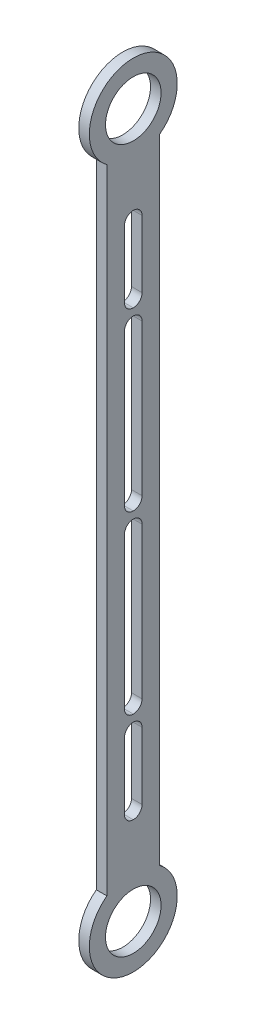
from build123d import *

# Parameters (mm, degrees)
SKETCH1_R           = 7.9
BOSS_EXTRUDE1_DEPTH = 3
SKETCH3_W           = 5
SKETCH3_H           = 150
CUT_EXTRUDE2_DEPTH  = 213.888468452
FILLET2_R           = 2.5
SKETCH4_W           = 5
SKETCH4_H           = 2
BOSS_EXTRUDE2_DEPTH = 3
FILLET3_R           = 2.5


with BuildPart() as part:
    # Sketch1 → Boss-Extrude1 (new body)
    with BuildSketch(Plane(origin=(0, 0, 0), x_dir=(0, 0, -1), z_dir=(1, 0, 0))):
        with BuildLine():
            Line((7.5, 10), (7.5, 190))
            ThreePointArc((7.5, 190), (0, 212.5), (-7.5, 190))
            Line((-7.5, 190), (-7.5, 10))
            ThreePointArc((-7.5, 10), (0, -12.5), (7.5, 10))
        make_face()
        Circle(SKETCH1_R, mode=Mode.SUBTRACT)
        with Locations((0, 200)):
            Circle(SKETCH1_R, mode=Mode.SUBTRACT)
    extrude(amount=BOSS_EXTRUDE1_DEPTH)

    # Sketch3 → Cut-Extrude2 (cut, through all)
    with BuildSketch(Plane(origin=(3, 0, 0), x_dir=(0, 0, -1), z_dir=(1, 0, 0))):
        with Locations((0, 100)):
            Rectangle(SKETCH3_W, SKETCH3_H)
    extrude(amount=-CUT_EXTRUDE2_DEPTH, mode=Mode.SUBTRACT)

    # Fillet2
    fillet2_edges = [part.edges().sort_by_distance(p)[0] for p in [
        (1.5, 175, 2.5),
        (1.5, 175, -2.5),
        (1.5, 25, 2.5),
        (1.5, 25, -2.5),
    ]]
    fillet(fillet2_edges, radius=FILLET2_R - 0.0001)  # a hair under: the kernel refuses the full size

    # Sketch4 → Boss-Extrude2 (add)
    with BuildSketch(Plane(origin=(3, 0, 0), x_dir=(0, 0, -1), z_dir=(1, 0, 0))):
        with Locations((0, 100.007044109)):
            Rectangle(SKETCH4_W, SKETCH4_H)
        with Locations((0, 50.007044109)):
            Rectangle(SKETCH4_W, SKETCH4_H)
        with Locations((0, 150.007044109)):
            Rectangle(SKETCH4_W, SKETCH4_H)
    extrude(amount=-BOSS_EXTRUDE2_DEPTH)

    # Fillet3
    fillet3_edges = [part.edges().sort_by_distance(p)[0] for p in [
        (1.5, 101.007044109, -2.5),
        (1.5, 101.007044109, 2.5),
        (1.5, 51.007044109, 2.5),
        (1.5, 51.007044109, -2.5),
        (1.5, 49.007044109, 2.5),
        (1.5, 49.007044109, -2.5),
        (1.5, 99.007044109, -2.5),
        (1.5, 99.007044109, 2.5),
        (1.5, 149.007044109, 2.5),
        (1.5, 149.007044109, -2.5),
        (1.5, 151.007044109, 2.5),
        (1.5, 151.007044109, -2.5),
    ]]
    fillet(fillet3_edges, radius=FILLET3_R - 0.0001)  # a hair under: the kernel refuses the full size


solid = part.part
